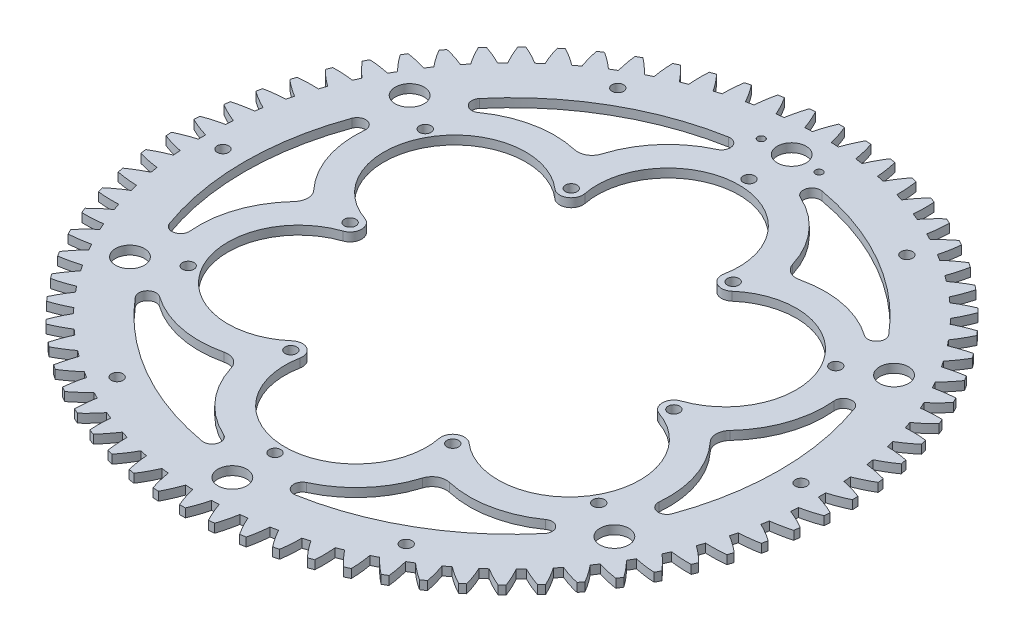
from build123d import *

# Parameters (mm, degrees)
EXTRUDE_1_OUTLINE_R      = 115
EXTRUDE_1_OUTLINE_R_2    = 2
EXTRUDE_1_DEPTH          = 3
CUT_EXTRUDE_1_DEPTH      = 163.662226715
PATTERN_CIRCULAR_1_COUNT = 74
SKETCH_5_R               = 5
SKETCH_5_R_2             = 1.25
CUT_EXTRUDE_3_DEPTH      = 162.202479803


with BuildPart() as part:
    # 凸台-拉伸1: read off the stored shape, not the designer's step
    # 凸台-拉伸1 outline → 凸台-拉伸1 (new body)
    with BuildSketch(Plane(origin=(0, 0, 0), x_dir=(1, 0, 0), z_dir=(0, 1, 0))):
        Circle(EXTRUDE_1_OUTLINE_R)
        with Locations((-50, -86.602540378)):
            Circle(EXTRUDE_1_OUTLINE_R_2, mode=Mode.SUBTRACT)
        with Locations((-71.01408311, -41)):
            Circle(EXTRUDE_1_OUTLINE_R_2, mode=Mode.SUBTRACT)
        with Locations((-28, -48.497422612)):
            Circle(EXTRUDE_1_OUTLINE_R_2, mode=Mode.SUBTRACT)
        with Locations((50, -86.602540378)):
            Circle(EXTRUDE_1_OUTLINE_R_2, mode=Mode.SUBTRACT)
        with Locations((0, -82)):
            Circle(EXTRUDE_1_OUTLINE_R_2, mode=Mode.SUBTRACT)
        with Locations((28, -48.497422612)):
            Circle(EXTRUDE_1_OUTLINE_R_2, mode=Mode.SUBTRACT)
        with Locations((71.01408311, -41)):
            Circle(EXTRUDE_1_OUTLINE_R_2, mode=Mode.SUBTRACT)
        with Locations((-100, 0)):
            Circle(EXTRUDE_1_OUTLINE_R_2, mode=Mode.SUBTRACT)
        with Locations((-71.01408311, 41)):
            Circle(EXTRUDE_1_OUTLINE_R_2, mode=Mode.SUBTRACT)
        with Locations((-56, 0)):
            Circle(EXTRUDE_1_OUTLINE_R_2, mode=Mode.SUBTRACT)
        with Locations((-28, 48.497422612)):
            Circle(EXTRUDE_1_OUTLINE_R_2, mode=Mode.SUBTRACT)
        with Locations((-50, 86.602540378)):
            Circle(EXTRUDE_1_OUTLINE_R_2, mode=Mode.SUBTRACT)
        with BuildLine():
            ThreePointArc((-30.630454045, 45.484000717), (-26, 45.033320997), (-24.075073064, 49.268751691))
            ThreePointArc((-24.075073064, 49.268751691), (0, 78.535563038), (24.075073064, 49.268751691))
            ThreePointArc((24.075073064, 49.268751691), (26, 45.033320997), (30.630454045, 45.484000717))
            ThreePointArc((30.630454045, 45.484000717), (68.013792692, 39.267781519), (54.705527109, 3.784750974))
            ThreePointArc((54.705527109, 3.784750974), (52, 0), (54.705527109, -3.784750974))
            ThreePointArc((54.705527109, -3.784750974), (68.013792692, -39.267781519), (30.630454045, -45.484000717))
            ThreePointArc((30.630454045, -45.484000717), (26, -45.033320997), (24.075073064, -49.268751691))
            ThreePointArc((24.075073064, -49.268751691), (0, -78.535563038), (-24.075073064, -49.268751691))
            ThreePointArc((-24.075073064, -49.268751691), (-26, -45.033320997), (-30.630454045, -45.484000717))
            ThreePointArc((-30.630454045, -45.484000717), (-68.013792692, -39.267781519), (-54.705527109, -3.784750974))
            ThreePointArc((-54.705527109, -3.784750974), (-52, 0), (-54.705527109, 3.784750974))
            ThreePointArc((-54.705527109, 3.784750974), (-68.013792692, 39.267781519), (-30.630454045, 45.484000717))
        make_face(mode=Mode.SUBTRACT)
        with Locations((56, 0)):
            Circle(EXTRUDE_1_OUTLINE_R_2, mode=Mode.SUBTRACT)
        with Locations((28, 48.497422612)):
            Circle(EXTRUDE_1_OUTLINE_R_2, mode=Mode.SUBTRACT)
        with Locations((100, 0)):
            Circle(EXTRUDE_1_OUTLINE_R_2, mode=Mode.SUBTRACT)
        with Locations((71.01408311, 41)):
            Circle(EXTRUDE_1_OUTLINE_R_2, mode=Mode.SUBTRACT)
        with Locations((0, 82)):
            Circle(EXTRUDE_1_OUTLINE_R_2, mode=Mode.SUBTRACT)
        with Locations((50, 86.602540378)):
            Circle(EXTRUDE_1_OUTLINE_R_2, mode=Mode.SUBTRACT)
    extrude(amount=EXTRUDE_1_DEPTH)

    # 草图4 → 切除-拉伸1 (cut, through all)
    with BuildSketch(Plane(origin=(0, 3, 0), x_dir=(1, 0, 0), z_dir=(0, 1, 0))):
        with BuildLine():
            Line((-0.997070202, 113.995639614), (-1.005816432, 114.995601365))
            ThreePointArc((-1.005816432, 114.995601365), (4.880738368, 114.896381114), (10.754501251, 114.496029201))
            Line((10.754501251, 114.496029201), (10.660983849, 113.500411556))
            ThreePointArc((10.660983849, 113.500411556), (9.66787539, 113.589313694), (8.674027359, 113.669526476))
            ThreePointArc((8.674027359, 113.669526476), (7.107828191, 110.438572062), (5.80781814, 107.091630156))
            ThreePointArc((5.80781814, 107.091630156), (4.551776602, 107.152365026), (3.29510929, 107.198368718))
            ThreePointArc((3.29510929, 107.198368718), (2.283623043, 110.643501782), (0.997070202, 113.995639614))
            ThreePointArc((0.997070202, 113.995639614), (0, 114), (-0.997070202, 113.995639614))
        make_face()
    cut_extrude_1 = extrude(amount=-CUT_EXTRUDE_1_DEPTH, mode=Mode.SUBTRACT)

    # 阵列(圆周)1: 切除-拉伸1 ×74 about axis
    pattern_circular_1_axis = Axis((0, 0, 0), (0, 1, 0))
    for i in range(1, PATTERN_CIRCULAR_1_COUNT):
        add(cut_extrude_1.rotate(pattern_circular_1_axis, i * 360 / PATTERN_CIRCULAR_1_COUNT), mode=Mode.SUBTRACT)

    # 草图5 → 切除-拉伸3 (cut, through all)
    with BuildSketch(Plane(origin=(0, 3, 0), x_dir=(1, 0, 0), z_dir=(0, 1, 0))):
        with Locations(Location((0, 96.75, 0), (0, 0, 270))):
            Circle(SKETCH_5_R)
        with Locations(Location((83.787957816, 48.375, 0), (0, 0, 270))):
            Circle(SKETCH_5_R)
        with Locations(Location((83.787957816, -48.375, 0), (0, 0, 270))):
            Circle(SKETCH_5_R)
        with Locations(Location((0, -96.75, 0), (0, 0, 270))):
            Circle(SKETCH_5_R)
        with Locations(Location((-83.787957816, -48.375, 0), (0, 0, 270))):
            Circle(SKETCH_5_R)
        with Locations(Location((-83.787957816, 48.375, 0), (0, 0, 270))):
            Circle(SKETCH_5_R)
        with Locations(Location((-10, 96.231816464, 0), (0, 0, 270))):
            Circle(SKETCH_5_R_2)
        with Locations(Location((10, 96.231816464, 0), (0, 0, 90))):
            Circle(SKETCH_5_R_2)
        with BuildLine():
            ThreePointArc((38.953701193, 60.64049519), (35.322740825, 61.180781772), (33.039358736, 64.055142399))
            ThreePointArc((33.039358736, 64.055142399), (26.003372795, 76.727290152), (14.387036172, 85.396151111))
            ThreePointArc((14.387036172, 85.396151111), (12.773144905, 89.01759358), (16.160932893, 91.077298203))
            ThreePointArc((16.160932893, 91.077298203), (46.25, 80.10734985), (70.794787506, 59.534427536))
            ThreePointArc((70.794787506, 59.534427536), (70.704924972, 55.570664764), (66.761718161, 55.157614365))
            ThreePointArc((66.761718161, 55.157614365), (53.446096038, 60.8832265), (38.953701193, 60.64049519))
        make_face()
        with BuildLine():
            ThreePointArc((71.993059929, -3.414647209), (70.645481651, 0), (71.993059929, 3.414647209))
            ThreePointArc((71.993059929, 3.414647209), (79.449468833, 15.844063652), (81.148754333, 30.238536745))
            ThreePointArc((81.148754333, 30.238536745), (83.478069877, 33.446928816), (86.955720399, 31.542870668))
            ThreePointArc((86.955720399, 31.542870668), (92.5, 0), (86.955720399, -31.542870668))
            ThreePointArc((86.955720399, -31.542870668), (83.478069877, -33.446928816), (81.148754333, -30.238536745))
            ThreePointArc((81.148754333, -30.238536745), (79.449468833, -15.844063652), (71.993059929, -3.414647209))
        make_face()
        with BuildLine():
            ThreePointArc((33.039358736, -64.055142399), (35.322740825, -61.180781772), (38.953701193, -60.64049519))
            ThreePointArc((38.953701193, -60.64049519), (53.446096038, -60.8832265), (66.761718161, -55.157614365))
            ThreePointArc((66.761718161, -55.157614365), (70.704924972, -55.570664764), (70.794787506, -59.534427536))
            ThreePointArc((70.794787506, -59.534427536), (46.25, -80.10734985), (16.160932893, -91.077298203))
            ThreePointArc((16.160932893, -91.077298203), (12.773144905, -89.01759358), (14.387036172, -85.396151111))
            ThreePointArc((14.387036172, -85.396151111), (26.003372795, -76.727290152), (33.039358736, -64.055142399))
        make_face()
        with BuildLine():
            ThreePointArc((-38.953701193, -60.64049519), (-35.322740825, -61.180781772), (-33.039358736, -64.055142399))
            ThreePointArc((-33.039358736, -64.055142399), (-26.003372795, -76.727290152), (-14.387036172, -85.396151111))
            ThreePointArc((-14.387036172, -85.396151111), (-12.773144905, -89.01759358), (-16.160932893, -91.077298203))
            ThreePointArc((-16.160932893, -91.077298203), (-46.25, -80.10734985), (-70.794787506, -59.534427536))
            ThreePointArc((-70.794787506, -59.534427536), (-70.704924972, -55.570664764), (-66.761718161, -55.157614365))
            ThreePointArc((-66.761718161, -55.157614365), (-53.446096038, -60.8832265), (-38.953701193, -60.64049519))
        make_face()
        with BuildLine():
            ThreePointArc((-71.993059929, 3.414647209), (-70.645481651, 0), (-71.993059929, -3.414647209))
            ThreePointArc((-71.993059929, -3.414647209), (-79.449468833, -15.844063652), (-81.148754333, -30.238536745))
            ThreePointArc((-81.148754333, -30.238536745), (-83.478069877, -33.446928816), (-86.955720399, -31.542870668))
            ThreePointArc((-86.955720399, -31.542870668), (-92.5, 0), (-86.955720399, 31.542870668))
            ThreePointArc((-86.955720399, 31.542870668), (-83.478069877, 33.446928816), (-81.148754333, 30.238536745))
            ThreePointArc((-81.148754333, 30.238536745), (-79.449468833, 15.844063652), (-71.993059929, 3.414647209))
        make_face()
        with BuildLine():
            ThreePointArc((-33.039358736, 64.055142399), (-35.322740825, 61.180781772), (-38.953701193, 60.64049519))
            ThreePointArc((-38.953701193, 60.64049519), (-53.446096038, 60.8832265), (-66.761718161, 55.157614365))
            ThreePointArc((-66.761718161, 55.157614365), (-70.704924972, 55.570664764), (-70.794787506, 59.534427536))
            ThreePointArc((-70.794787506, 59.534427536), (-46.25, 80.10734985), (-16.160932893, 91.077298203))
            ThreePointArc((-16.160932893, 91.077298203), (-12.773144905, 89.01759358), (-14.387036172, 85.396151111))
            ThreePointArc((-14.387036172, 85.396151111), (-26.003372795, 76.727290152), (-33.039358736, 64.055142399))
        make_face()
    extrude(amount=-CUT_EXTRUDE_3_DEPTH, mode=Mode.SUBTRACT)


solid = part.part
